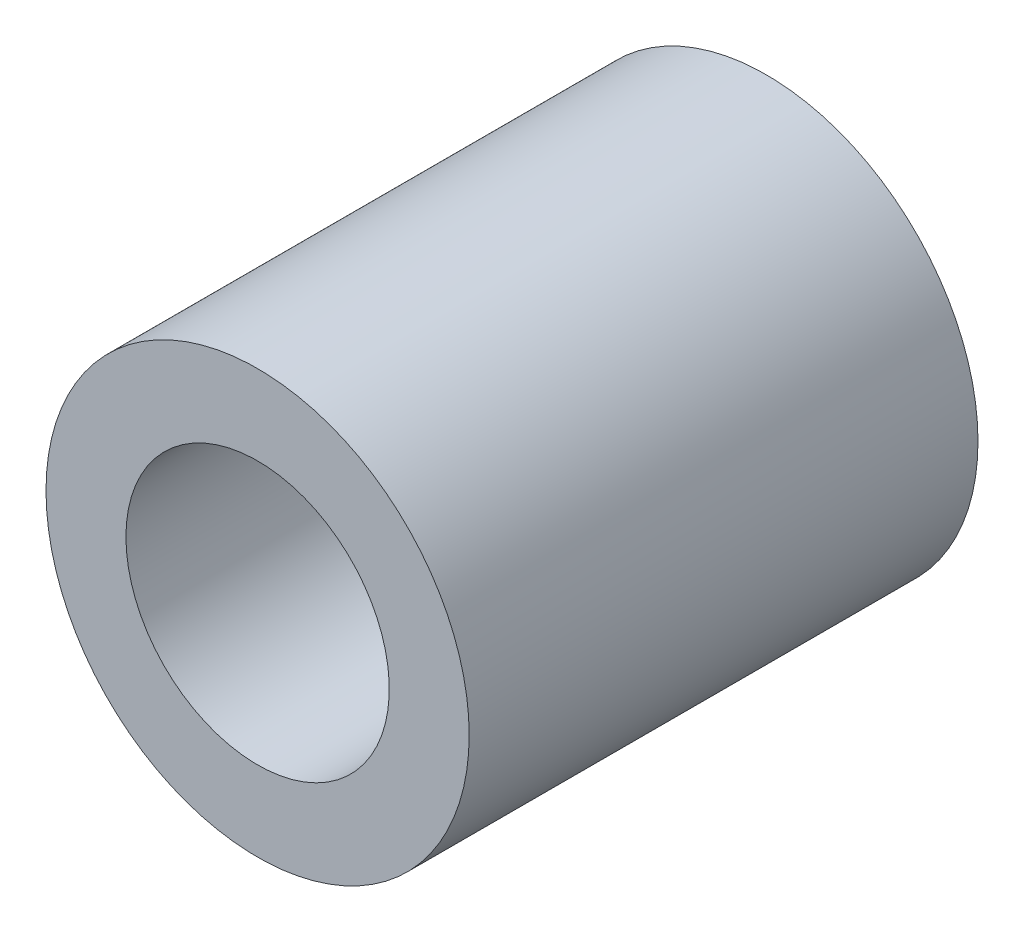
from build123d import *

# Parameters (mm, degrees)
SKETCH1_R              = 4
BOSS_EXTRUDE1_DEPTH    = 9.61875
F_10_CLEARANCE_HOLE1_D = 4.9784


with BuildPart() as part:
    # Sketch1 → Boss-Extrude1 (new body)
    with BuildSketch(Plane.XY):
        Circle(SKETCH1_R)
    extrude(amount=BOSS_EXTRUDE1_DEPTH)

    # #10 Clearance Hole1 (through all)
    with Locations(Plane(origin=(0, 0, 0), x_dir=(-1, 0, 0), z_dir=(0, 0, -1))):
        with Locations((0, 0)):
            Hole(F_10_CLEARANCE_HOLE1_D / 2)


solid = part.part
